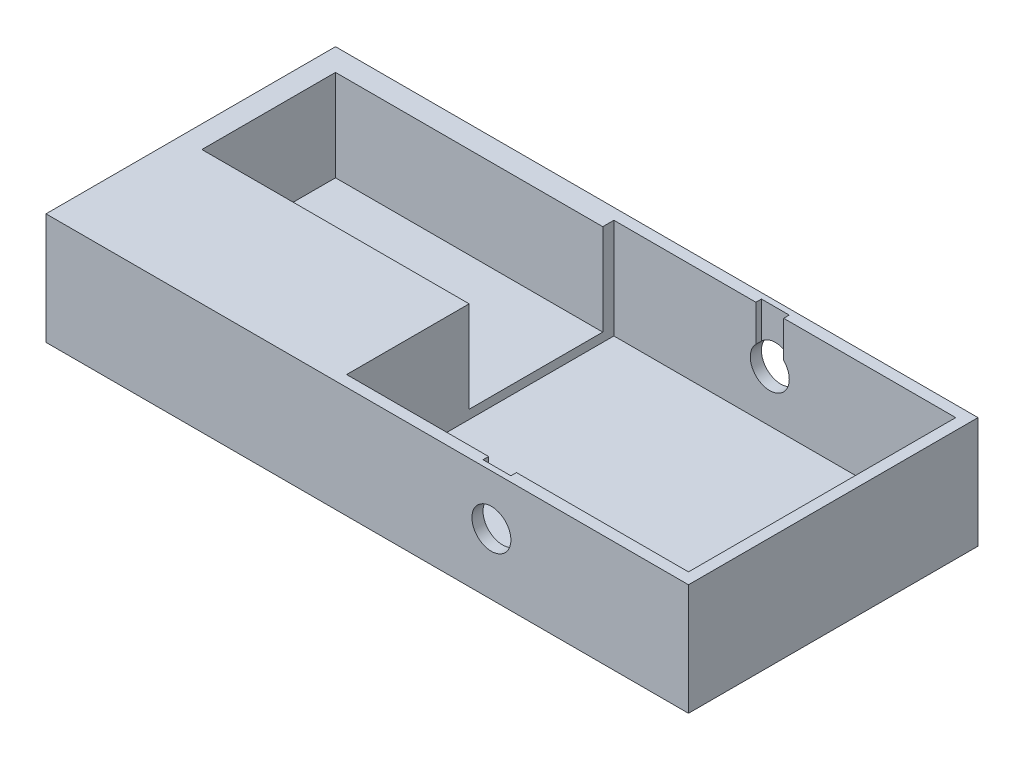
from build123d import *

# Parameters (mm, degrees)
SKETCH1_W                 = 77.978
SKETCH1_H                 = 60.96
PCB_BASE_DEPTH            = 2.54
SKETCH1_4_W               = 83.058
SKETCH1_4_H               = 66.04
SKETCH1_4_W_2             = 77.978
SKETCH1_4_H_2             = 60.96
PCB_WALL_DEPTH            = 25.4
SKETCH4_R                 = 4.445
LID_HOLE_1_DEPTH          = 3.81
HOLE_SLIDE_1_DEPTH        = 1.27
LID_HOLE_2_START          = -3.81
SKETCH3_R                 = 4.445
LID_HOLE_2_DEPTH          = 3.81
HOLE_SLIDE_2_START        = -1.27
HOLE_SLIDE_2_DEPTH        = 1.27
BATTERY_COMPARTMENT_DEPTH = 60.96
BACK_WALL_DEPTH           = 2.54
BACK_WALL_DEPTH_BACK      = 2.54
SKETCH5_W                 = 66.04
SKETCH5_H                 = 25.4
SKETCH8_W                 = 30.48
SKETCH8_H                 = 20.828
PCB_GAP_DEPTH             = 2.54


with BuildPart() as part:
    # Sketch1 → pcb-base (new body)
    with BuildSketch(Plane(origin=(0, 0, 0), x_dir=(1, 0, 0), z_dir=(0, 1, 0))):
        Rectangle(SKETCH1_W, SKETCH1_H)
    extrude(amount=PCB_BASE_DEPTH)

    # Sketch1<4> → pcb-wall (add)
    with BuildSketch(Plane(origin=(0, 0, 0), x_dir=(1, 0, 0), z_dir=(0, 1, 0))):
        Rectangle(SKETCH1_4_W, SKETCH1_4_H)
        Rectangle(SKETCH1_4_W_2, SKETCH1_4_H_2, mode=Mode.SUBTRACT)
    extrude(amount=PCB_WALL_DEPTH)

    # Sketch4 → lid-hole-1 (cut)
    with BuildSketch(Plane(origin=(0, 0, 30.48), x_dir=(-1, 0, 0), z_dir=(0, 0, -1))):
        with Locations((3.429, 13.97)):
            Circle(SKETCH4_R)
    extrude(amount=-LID_HOLE_1_DEPTH, mode=Mode.SUBTRACT)

    # Sketch4<6> → hole-slide-1 (cut)
    with BuildSketch(Plane(origin=(0, 0, 30.48), x_dir=(-1, 0, 0), z_dir=(0, 0, -1))):
        with BuildLine():
            Line((6.604, 25.4), (0.254, 25.4))
            Line((0.254, 25.4), (0.254, 17.080851973))
            ThreePointArc((0.254, 17.080851973), (3.429, 18.415), (6.604, 17.080851973))
            Line((6.604, 17.080851973), (6.604, 25.4))
        make_face()
    extrude(amount=-HOLE_SLIDE_1_DEPTH, mode=Mode.SUBTRACT)

    # Sketch3 → lid-hole-2 (cut)
    with BuildSketch(Plane.XY.offset(-30.48).offset(LID_HOLE_2_START)):
        with Locations((-3.429, 13.97)):
            Circle(SKETCH3_R)
    extrude(amount=LID_HOLE_2_DEPTH, mode=Mode.SUBTRACT)

    # Sketch3<5> → hole-slide-2 (cut)
    with BuildSketch(Plane.XY.offset(-30.48).offset(HOLE_SLIDE_2_START)):
        with BuildLine():
            Line((-6.604, 25.4), (-6.604, 17.080851973))
            ThreePointArc((-6.604, 17.080851973), (-3.429, 18.415), (-0.254, 17.080851973))
            Line((-0.254, 17.080851973), (-0.254, 25.4))
            Line((-0.254, 25.4), (-6.604, 25.4))
        make_face()
    extrude(amount=HOLE_SLIDE_2_DEPTH, mode=Mode.SUBTRACT)

    # Sketch2 → battery-compartment (add)
    with BuildSketch(Plane.ZY.offset(41.529)):
        Polygon((-27.94, 4.572), (2.54, 4.572), (2.54, 25.4), (33.02, 25.4), (33.02, 0), (-33.02, 0), (-33.02, 25.4), (-27.94, 25.4), align=None)
    extrude(amount=BATTERY_COMPARTMENT_DEPTH)

    # Sketch5 → back-wall (add, two sides: drawn at the far end of the back side and taken through both)
    with BuildSketch(Plane.ZY.offset(102.489).offset(-BACK_WALL_DEPTH_BACK)):
        with Locations((0, 12.7)):
            Rectangle(SKETCH5_W, SKETCH5_H)
    extrude(amount=BACK_WALL_DEPTH + BACK_WALL_DEPTH_BACK)

    # Sketch8 → pcb-gap (cut)
    with BuildSketch(Plane.ZY.offset(41.529)):
        with Locations((-12.7, 14.986)):
            Rectangle(SKETCH8_W, SKETCH8_H)
    extrude(amount=-PCB_GAP_DEPTH, mode=Mode.SUBTRACT)


solid = part.part
